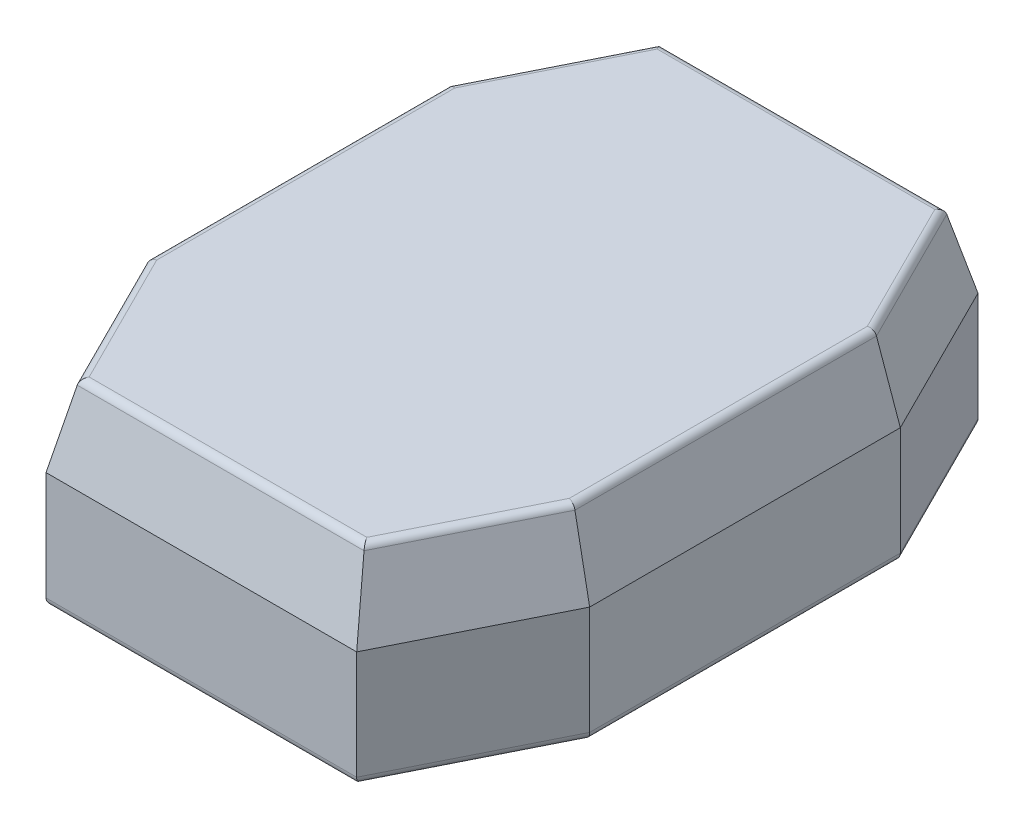
from build123d import *

# Parameters (mm, degrees)
BOSS_EXTRUDE1_DEPTH = 2.54
BOSS_EXTRUDE1_TAPER = 15
BOSS_EXTRUDE2_DEPTH = 3.8
FILLET2_R           = 0.1
CHAMFER1_SIZE       = 0.2
BOSS_EXTRUDE3_DEPTH = 3.8
FILLET3_R           = 0.25
FILLET5_R           = 0.5
FILLET6_R           = 0.1
FILLET7_R           = 0.25


with BuildPart() as part:
    # Sketch1 → Boss-Extrude1 (new body)
    with BuildSketch(Plane(origin=(0, 0, 0), x_dir=(1, 0, 0), z_dir=(0, 1, 0))):
        Polygon((-7.62, 5.08), (-7.62, -5.08), (-5.08, -10.16), (5.08, -10.16), (7.62, -5.08), (7.62, 5.08), (5.08, 10.16), (-5.08, 10.16), align=None)
    extrude(amount=BOSS_EXTRUDE1_DEPTH, taper=BOSS_EXTRUDE1_TAPER)

    # Stem → Boss-Extrude2 (add)
    with BuildSketch(Plane.XZ):
        with BuildLine():
            Line((2.499999969, 2.5), (-2.499999969, 2.5))
            ThreePointArc((-2.499999969, 2.5), (-2.85355336, 2.353553391), (-2.999999969, 2))
            Line((-2.999999969, 2), (-2.999999969, -2))
            ThreePointArc((-2.999999969, -2), (-2.85355336, -2.353553391), (-2.499999969, -2.5))
            Line((-2.499999969, -2.5), (2.499999969, -2.5))
            ThreePointArc((2.499999969, -2.5), (2.85355336, -2.353553391), (2.999999969, -2))
            Line((2.999999969, -2), (2.999999969, 2))
            ThreePointArc((2.999999969, 2), (2.85355336, 2.353553391), (2.499999969, 2.5))
        make_face()
        Polygon((-0.5625, 0.6625), (-0.5625, 2.075), (0.5625, 2.075), (0.5625, 0.6625), (2.0625, 0.6625), (2.0625, -0.6625), (0.5625, -0.6625), (0.5625, -2.075), (-0.5625, -2.075), (-0.5625, -0.6625), (-2.0625, -0.6625), (-2.0625, 0.6625), align=None, mode=Mode.SUBTRACT)
    extrude(amount=BOSS_EXTRUDE2_DEPTH)

    # Fillet2
    fillet2_edges = [part.edges().sort_by_distance(p)[0] for p in [
        (-2.85355336, -3.8, -2.353553391),
        (-2.999999969, -3.8, 0),
        (-2.85355336, -3.8, 2.353553391),
        (0, -3.8, 2.5),
        (2.85355336, -3.8, 2.353553391),
        (2.999999969, -3.8, 0),
        (2.85355336, -3.8, -2.353553391),
        (0, -3.8, -2.5),
    ]]
    fillet(fillet2_edges, radius=FILLET2_R)

    # Chamfer1
    chamfer1_edges = [part.edges().sort_by_distance(p)[0] for p in [
        (-0.5625, -3.8, -1.36875),
        (-1.3125, -3.8, -0.6625),
        (-2.0625, -3.8, 0),
        (0.5625, -3.8, -1.36875),
        (1.3125, -3.8, -0.6625),
        (2.0625, -3.8, 0),
        (1.3125, -3.8, 0.6625),
        (0.5625, -3.8, 1.36875),
        (0, -3.8, 2.075),
        (-0.5625, -3.8, 1.36875),
        (-1.3125, -3.8, 0.6625),
    ]]
    chamfer(chamfer1_edges, length=CHAMFER1_SIZE)

    # Sketch3 → Boss-Extrude3 (add)
    with BuildSketch(Plane.XZ):
        Polygon((-7.62, 5.08), (-7.62, -5.08), (-5.08, -10.16), (5.08, -10.16), (7.62, -5.08), (7.62, 5.08), (5.08, 10.16), (-5.08, 10.16), align=None)
        Polygon((-6.35, -4.780193669), (-4.295096834, -8.89), (4.295096834, -8.89), (6.35, -4.780193669), (6.35, 4.780193669), (4.295096834, 8.89), (-4.295096834, 8.89), (-6.35, 4.780193669), align=None, mode=Mode.SUBTRACT)
    extrude(amount=BOSS_EXTRUDE3_DEPTH)

    # Fillet3
    fillet3_edges = [part.edges().sort_by_distance(p)[0] for p in [
        (0, -3.8, -8.89),
        (5.322548417, -3.8, -6.835096834),
        (6.35, -3.8, 0),
        (5.322548417, -3.8, 6.835096834),
        (0, -3.8, 8.89),
        (-5.322548417, -3.8, 6.835096834),
        (-6.35, -3.8, 0),
        (-5.322548417, -3.8, -6.835096834),
        (0, -3.8, 10.16),
        (6.35, -3.8, 7.62),
        (7.62, -3.8, 0),
        (6.35, -3.8, -7.62),
        (0, -3.8, -10.16),
        (-6.35, -3.8, -7.62),
        (-7.62, -3.8, 0),
        (-6.35, -3.8, 7.62),
    ]]
    fillet(fillet3_edges, radius=FILLET3_R)

    # Fillet5
    fillet5_edges = [part.edges().sort_by_distance(p)[0] for p in [
        (0, 0, 2.5),
        (-2.85355336, 0, 2.353553391),
        (-2.999999969, 0, 0),
        (-2.85355336, 0, -2.353553391),
        (0, 0, -2.5),
        (2.85355336, 0, -2.353553391),
        (2.999999969, 0, 0),
        (2.85355336, 0, 2.353553391),
        (-5.322548417, 0, 6.835096834),
        (0, 0, 8.89),
        (5.322548417, 0, 6.835096834),
        (6.35, 0, 0),
        (5.322548417, 0, -6.835096834),
        (0, 0, -8.89),
        (-5.322548417, 0, -6.835096834),
        (-6.35, 0, 0),
    ]]
    fillet(fillet5_edges, radius=FILLET5_R)

    # Fillet6
    fillet6_edges = [part.edges().sort_by_distance(p)[0] for p in [
        (-1.3125, 0, 0.6625),
        (-0.5625, 0, 1.36875),
        (0, 0, 2.075),
        (0.5625, 0, 1.36875),
        (1.3125, 0, 0.6625),
        (2.0625, 0, 0),
        (1.3125, 0, -0.6625),
        (0.5625, 0, -1.36875),
        (0, 0, -2.075),
        (-0.5625, 0, -1.36875),
        (-1.3125, 0, -0.6625),
        (-2.0625, 0, 0),
    ]]
    fillet(fillet6_edges, radius=FILLET6_R)

    # Fillet7
    fillet7_edges = [part.edges().sort_by_distance(p)[0] for p in [
        (5.799390356, 2.54, -7.199371661),
        (6.939409051, 2.54, 0),
        (5.799390356, 2.54, 7.199371661),
        (0, 2.54, 9.479409051),
        (-5.799390356, 2.54, 7.199371661),
        (-6.939409051, 2.54, 0),
        (-5.799390356, 2.54, -7.199371661),
        (0, 2.54, -9.479409051),
    ]]
    fillet(fillet7_edges, radius=FILLET7_R)


solid = part.part
